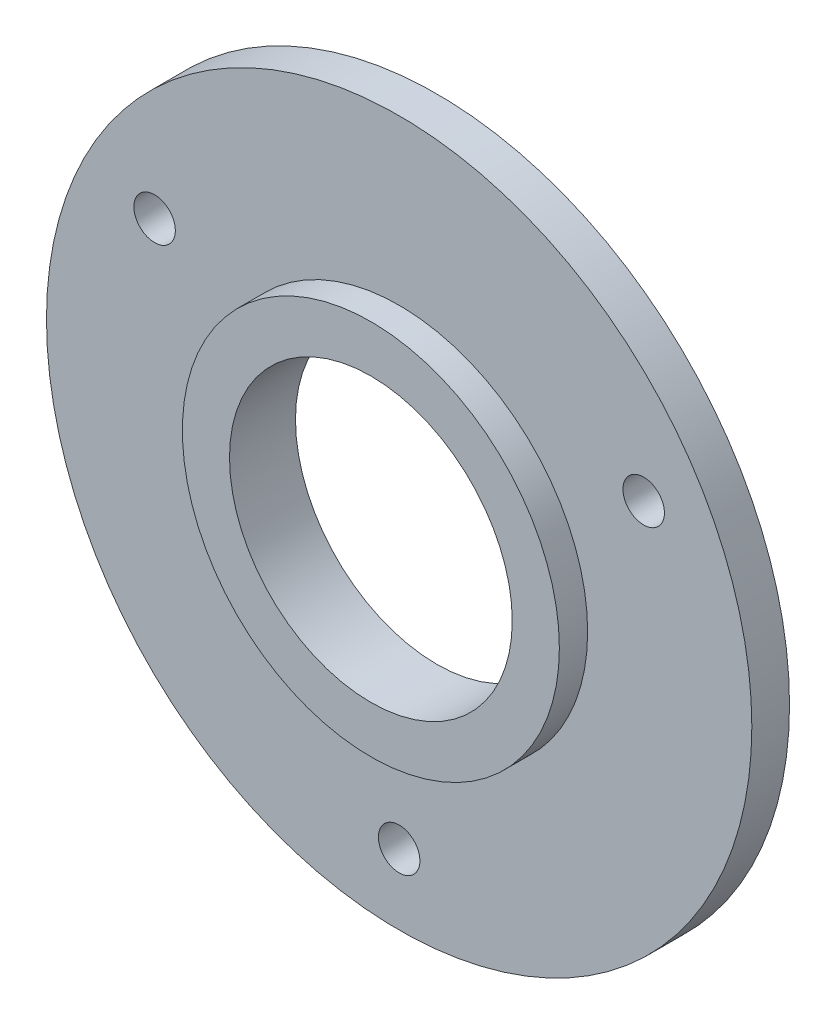
from build123d import *

# Parameters (mm, degrees)
SKETCH1_R           = 18.71
SKETCH1_R_2         = 1.1
SKETCH1_R_3         = 7.5
BOSS_EXTRUDE1_DEPTH = 2
SKETCH2_R           = 10
SKETCH2_R_2         = 7.5
BOSS_EXTRUDE2_DEPTH = 1.5


with BuildPart() as part:
    # Sketch1 → Boss-Extrude1 (new body)
    with BuildSketch(Plane.XY):
        Circle(SKETCH1_R)
        with Locations((0, -14.98)):
            Circle(SKETCH1_R_2, mode=Mode.SUBTRACT)
        with Locations((-12.973060549, 7.49)):
            Circle(SKETCH1_R_2, mode=Mode.SUBTRACT)
        with Locations((12.973060549, 7.49)):
            Circle(SKETCH1_R_2, mode=Mode.SUBTRACT)
        Circle(SKETCH1_R_3, mode=Mode.SUBTRACT)
    extrude(amount=BOSS_EXTRUDE1_DEPTH)

    # Sketch2 → Boss-Extrude2 (add)
    with BuildSketch(Plane.XY.offset(2)):
        Circle(SKETCH2_R)
        Circle(SKETCH2_R_2, mode=Mode.SUBTRACT)
    extrude(amount=BOSS_EXTRUDE2_DEPTH)


solid = part.part
